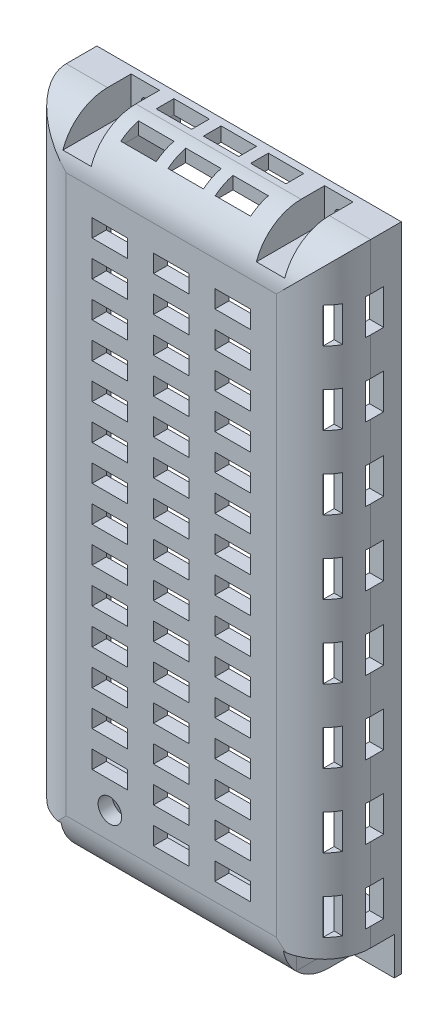
from build123d import *

# Parameters (mm, degrees)
ESBO_O1_W                = 129
ESBO_O1_H                = 276
ESBO_O1_R                = 1.6
RESSALTO_EXTRUS_O1_DEPTH = 3
ESBO_O4_W                = 70
ESBO_O4_H                = 6
ESBO_O4_W_2              = 6
ESBO_O4_H_2              = 100
RESSALTO_EXTRUS_O2_DEPTH = 24
RESSALTO_EXTRUS_O3_DEPTH = 6
RESSALTO_EXTRUS_O5_DEPTH = 27
RESSALTO_EXTRUS_O6_DEPTH = 94
FILETE1_R                = 20
ESBO_O9_R                = 5
ESBO_O9_W                = 15
ESBO_O9_H                = 7.5
CORTE_EXTRUS_O1_DEPTH    = 6
ESBO_O10_W               = 15
ESBO_O10_H               = 7.5
CORTE_EXTRUS_O2_DEPTH    = 6
ESBO_O11_W               = 15
ESBO_O11_H               = 7.5
CORTE_EXTRUS_O3_DEPTH    = 6
ESBO_O12_W               = 7.5
ESBO_O12_H               = 15
CORTE_EXTRUS_O4_DEPTH    = 6


with BuildPart() as part:
    # Esboço1 → Ressalto-extrusão1 (new body)
    with BuildSketch(Plane.XY):
        Rectangle(ESBO_O1_W, ESBO_O1_H)
        with Locations((-53.125, -128)):
            Circle(ESBO_O1_R, mode=Mode.SUBTRACT)
        with Locations((-41, 130.5)):
            Circle(ESBO_O1_R, mode=Mode.SUBTRACT)
        with Locations(Location((41, 130.5, 0), (0, 0, 180))):
            Circle(ESBO_O1_R, mode=Mode.SUBTRACT)
        with Locations(Location((53.125, -128, 0), (0, 0, 180))):
            Circle(ESBO_O1_R, mode=Mode.SUBTRACT)
        Polygon((-47.125, -132), (-47.125, -122), (-58.5, -122), (-58.5, 132), (-47, 132), (-47, 124.5), (-35, 124.5), (-35, 132), (35, 132), (35, 124.5), (47, 124.5), (47, 132), (58.5, 132), (58.5, -122), (47.125, -122), (47.125, -132), align=None, mode=Mode.SUBTRACT)
    extrude(amount=RESSALTO_EXTRUS_O1_DEPTH)

    # Esboço4 → Ressalto-extrusão2 (add)
    with BuildSketch(Plane.XY.offset(3)):
        Polygon((-64.5, 138), (-64.5, 72), (-58.5, 72), (-58.5, 132), (-47, 132), (-47, 138), align=None)
        with Locations((0, 135)):
            Rectangle(ESBO_O4_W, ESBO_O4_H)
        Polygon((47, 132), (47, 138), (64.5, 138), (64.5, 72), (58.5, 72), (58.5, 132), align=None)
        Polygon((-47.125, -132), (-47.125, -138), (47, -138), (47.125, -132), align=None)
        with Locations((-61.5, -72)):
            Rectangle(ESBO_O4_W_2, ESBO_O4_H_2)
        with Locations((61.5, -72)):
            Rectangle(ESBO_O4_W_2, ESBO_O4_H_2)
    extrude(amount=RESSALTO_EXTRUS_O2_DEPTH)

    # Esboço5 → Ressalto-extrusão3 (add)
    with BuildSketch(Plane.XY.offset(27)):
        Polygon((-35, 132), (-35, 138), (35, 138), (35, 132), (35, 124.5), (47, 124.5), (47, 132), (47, 138), (64.5, 138), (64.5, 72), (58.5, 72), (-64.5, 72), (-64.5, 138), (-47, 138), (-47, 124.5), (-35, 124.5), align=None)
        Polygon((-47.125, -138), (47, -138), (47.125, -122), (64.5, -122), (64.5, -22), (-64.5, -22), (-64.5, -122), (-47.125, -122), align=None)
    extrude(amount=RESSALTO_EXTRUS_O3_DEPTH)

    # Esboço7 → Ressalto-extrusão5 (add)
    with BuildSketch(Plane(origin=(0, 0, 27), x_dir=(-1, 0, 0), z_dir=(0, 0, -1))):
        Polygon((-47, 132), (-53, 132), (-53, 118.5), (-29, 118.5), (-29, 132), (-35, 132), (-35, 124.5), (-47, 124.5), align=None)
        Polygon((47.125, -132), (47.125, -122), (58.5, -122), (58.5, -116), (41.125, -116), (41.125, -132), align=None)
        Polygon((47, 124.5), (47, 132), (53, 132), (53, 118.5), (29, 118.5), (29, 132), (35, 132), (35, 124.5), align=None)
        Polygon((-41.125, -132), (-47.125, -132), (-47.125, -122), (-58.5, -122), (-58.5, -116), (-41.125, -116), align=None)
    extrude(amount=RESSALTO_EXTRUS_O5_DEPTH)

    # Esboço8 → Ressalto-extrusão6 (add)
    with BuildSketch(Plane(origin=(0, -22, 0), x_dir=(1, 0, 0), z_dir=(0, 1, 0))):
        Polygon((-58.5, -3), (-64.5, -3), (-64.5, -33), (64.5, -33), (64.5, -3), (58.5, -3), (58.5, -27), (-58.5, -27), align=None)
    extrude(amount=RESSALTO_EXTRUS_O6_DEPTH)

    # Filete1
    # the kernel refuses this fillet: 20 mm, written as the material it takes off along each edge
    with BuildSketch(Plane(origin=(-85, 138, 33), x_dir=(0, 0, -1), z_dir=(1, 0, 0))) as filete1_piece_1:
        with BuildLine():
            CenterArc((FILETE1_R, -FILETE1_R), FILETE1_R, 90, 90)
            Line((0, -FILETE1_R), (0, 0))
            Line((0, 0), (FILETE1_R, 0))
        make_face()
    extrude(amount=170, mode=Mode.SUBTRACT)
    with BuildSketch(Plane(origin=(-97.125, -138, 33), x_dir=(0, 0, -1), z_dir=(1, 0, 0))) as filete1_piece_2:
        with BuildLine():
            CenterArc((FILETE1_R, FILETE1_R), FILETE1_R, 180, 90)
            Line((0, FILETE1_R), (0, 0))
            Line((0, 0), (FILETE1_R, 0))
        make_face()
    extrude(amount=194.125, mode=Mode.SUBTRACT)
    with BuildSketch(Plane(origin=(64.5, -172, 33), x_dir=(0, 0, -1), z_dir=(0, 1, 0)), Plane(origin=(-64.5, -172, 33), x_dir=(1, 0, 0), z_dir=(0, 1, 0))) as filete1_piece_3:
        with BuildLine():
            CenterArc((FILETE1_R, FILETE1_R), FILETE1_R, 180, 90)
            Line((0, FILETE1_R), (0, 0))
            Line((0, 0), (FILETE1_R, 0))
        make_face()
    extrude(amount=360, mode=Mode.SUBTRACT)

    # Esboço9 → Corte-extrusão1 (cut)
    with BuildSketch(Plane.XY.offset(33)):
        with Locations((-26, -106.75)):
            Circle(ESBO_O9_R)
        with Locations((0, -106.75)):
            Rectangle(ESBO_O9_W, ESBO_O9_H)
        with Locations((26, -106.75)):
            Rectangle(ESBO_O9_W, ESBO_O9_H)
        with Locations((-26, -91.75)):
            Rectangle(ESBO_O9_W, ESBO_O9_H)
        with Locations((0, -91.75)):
            Rectangle(ESBO_O9_W, ESBO_O9_H)
        with Locations((26, -91.75)):
            Rectangle(ESBO_O9_W, ESBO_O9_H)
        with Locations((-26, -76.75)):
            Rectangle(ESBO_O9_W, ESBO_O9_H)
        with Locations((0, -76.75)):
            Rectangle(ESBO_O9_W, ESBO_O9_H)
        with Locations((26, -76.75)):
            Rectangle(ESBO_O9_W, ESBO_O9_H)
        with Locations((-26, -61.75)):
            Rectangle(ESBO_O9_W, ESBO_O9_H)
        with Locations((0, -61.75)):
            Rectangle(ESBO_O9_W, ESBO_O9_H)
        with Locations((26, -61.75)):
            Rectangle(ESBO_O9_W, ESBO_O9_H)
        with Locations((-26, -46.75)):
            Rectangle(ESBO_O9_W, ESBO_O9_H)
        with Locations((0, -46.75)):
            Rectangle(ESBO_O9_W, ESBO_O9_H)
        with Locations((26, -46.75)):
            Rectangle(ESBO_O9_W, ESBO_O9_H)
        with Locations((-26, -31.75)):
            Rectangle(ESBO_O9_W, ESBO_O9_H)
        with Locations((0, -31.75)):
            Rectangle(ESBO_O9_W, ESBO_O9_H)
        with Locations((26, -31.75)):
            Rectangle(ESBO_O9_W, ESBO_O9_H)
        with Locations((-26, -16.75)):
            Rectangle(ESBO_O9_W, ESBO_O9_H)
        with Locations((0, -16.75)):
            Rectangle(ESBO_O9_W, ESBO_O9_H)
        with Locations((26, -16.75)):
            Rectangle(ESBO_O9_W, ESBO_O9_H)
        with Locations((-26, -1.75)):
            Rectangle(ESBO_O9_W, ESBO_O9_H)
        with Locations((0, -1.75)):
            Rectangle(ESBO_O9_W, ESBO_O9_H)
        with Locations((26, -1.75)):
            Rectangle(ESBO_O9_W, ESBO_O9_H)
        with Locations((-26, 13.25)):
            Rectangle(ESBO_O9_W, ESBO_O9_H)
        with Locations((0, 13.25)):
            Rectangle(ESBO_O9_W, ESBO_O9_H)
        with Locations((26, 13.25)):
            Rectangle(ESBO_O9_W, ESBO_O9_H)
        with Locations((-26, 28.25)):
            Rectangle(ESBO_O9_W, ESBO_O9_H)
        with Locations((0, 28.25)):
            Rectangle(ESBO_O9_W, ESBO_O9_H)
        with Locations((26, 28.25)):
            Rectangle(ESBO_O9_W, ESBO_O9_H)
        with Locations((-26, 43.25)):
            Rectangle(ESBO_O9_W, ESBO_O9_H)
        with Locations((0, 43.25)):
            Rectangle(ESBO_O9_W, ESBO_O9_H)
        with Locations((26, 43.25)):
            Rectangle(ESBO_O9_W, ESBO_O9_H)
        with Locations((-26, 58.25)):
            Rectangle(ESBO_O9_W, ESBO_O9_H)
        with Locations((0, 58.25)):
            Rectangle(ESBO_O9_W, ESBO_O9_H)
        with Locations((26, 58.25)):
            Rectangle(ESBO_O9_W, ESBO_O9_H)
        with Locations((-26, 73.25)):
            Rectangle(ESBO_O9_W, ESBO_O9_H)
        with Locations((0, 73.25)):
            Rectangle(ESBO_O9_W, ESBO_O9_H)
        with Locations((26, 73.25)):
            Rectangle(ESBO_O9_W, ESBO_O9_H)
        with Locations((-26, 88.25)):
            Rectangle(ESBO_O9_W, ESBO_O9_H)
        with Locations((0, 88.25)):
            Rectangle(ESBO_O9_W, ESBO_O9_H)
        with Locations((26, 88.25)):
            Rectangle(ESBO_O9_W, ESBO_O9_H)
        with Locations((-26, 103.25)):
            Rectangle(ESBO_O9_W, ESBO_O9_H)
        with Locations((0, 103.25)):
            Rectangle(ESBO_O9_W, ESBO_O9_H)
        with Locations((26, 103.25)):
            Rectangle(ESBO_O9_W, ESBO_O9_H)
    extrude(amount=-CORTE_EXTRUS_O1_DEPTH, mode=Mode.SUBTRACT)

    # Esboço10 → Corte-extrusão2 (cut)
    with BuildSketch(Plane.XZ.offset(138)):
        with Locations((-32.125, 24.25)):
            Rectangle(ESBO_O10_W, ESBO_O10_H)
        with Locations((-2.125, 24.25)):
            Rectangle(ESBO_O10_W, ESBO_O10_H)
        with Locations((27.875, 24.25)):
            Rectangle(ESBO_O10_W, ESBO_O10_H)
        with Locations((-32.125, 11.75)):
            Rectangle(ESBO_O10_W, ESBO_O10_H)
        with Locations((-2.125, 11.75)):
            Rectangle(ESBO_O10_W, ESBO_O10_H)
        with Locations((27.875, 11.75)):
            Rectangle(ESBO_O10_W, ESBO_O10_H)
    extrude(amount=-CORTE_EXTRUS_O2_DEPTH, mode=Mode.SUBTRACT)

    # Esboço11 → Corte-extrusão3 (cut)
    with BuildSketch(Plane(origin=(0, 138, 0), x_dir=(1, 0, 0), z_dir=(0, 1, 0))):
        with Locations((-21.365084691, -21.75)):
            Rectangle(ESBO_O11_W, ESBO_O11_H)
        with Locations((-1.365084691, -21.75)):
            Rectangle(ESBO_O11_W, ESBO_O11_H)
        with Locations((18.634915309, -21.75)):
            Rectangle(ESBO_O11_W, ESBO_O11_H)
        with Locations((-1.365084691, -6.75)):
            Rectangle(ESBO_O11_W, ESBO_O11_H)
        with Locations((18.634915309, -6.75)):
            Rectangle(ESBO_O11_W, ESBO_O11_H)
        with Locations((-21.365084691, -6.75)):
            Rectangle(ESBO_O11_W, ESBO_O11_H)
    extrude(amount=-CORTE_EXTRUS_O3_DEPTH, mode=Mode.SUBTRACT)

    # Esboço12 → Corte-extrusão4 (cut)
    with BuildSketch(Plane.ZY.offset(64.5)):
        with Locations((11.25, 110.5)):
            Rectangle(ESBO_O12_W, ESBO_O12_H)
        with Locations((26.25, 110.5)):
            Rectangle(ESBO_O12_W, ESBO_O12_H)
        with Locations((26.25, 79.5)):
            Rectangle(ESBO_O12_W, ESBO_O12_H)
        with Locations((26.25, 48.5)):
            Rectangle(ESBO_O12_W, ESBO_O12_H)
        with Locations((26.25, 17.5)):
            Rectangle(ESBO_O12_W, ESBO_O12_H)
        with Locations((26.25, -13.5)):
            Rectangle(ESBO_O12_W, ESBO_O12_H)
        with Locations((26.25, -44.5)):
            Rectangle(ESBO_O12_W, ESBO_O12_H)
        with Locations((26.25, -75.5)):
            Rectangle(ESBO_O12_W, ESBO_O12_H)
        with Locations((26.25, -106.5)):
            Rectangle(ESBO_O12_W, ESBO_O12_H)
        with Locations((11.25, 79.5)):
            Rectangle(ESBO_O12_W, ESBO_O12_H)
        with Locations((11.25, 48.5)):
            Rectangle(ESBO_O12_W, ESBO_O12_H)
        with Locations((11.25, 17.5)):
            Rectangle(ESBO_O12_W, ESBO_O12_H)
        with Locations((11.25, -13.5)):
            Rectangle(ESBO_O12_W, ESBO_O12_H)
        with Locations((11.25, -44.5)):
            Rectangle(ESBO_O12_W, ESBO_O12_H)
        with Locations((11.25, -75.5)):
            Rectangle(ESBO_O12_W, ESBO_O12_H)
        with Locations((11.25, -106.5)):
            Rectangle(ESBO_O12_W, ESBO_O12_H)
    corte_extrus_o4 = extrude(amount=-CORTE_EXTRUS_O4_DEPTH, mode=Mode.SUBTRACT)

    # Espelhar2: Corte-extrusão4 across plane
    add(corte_extrus_o4.mirror(Plane(origin=(0, 0, 0), x_dir=(0, 0, 1), z_dir=(1, 0, 0))), mode=Mode.SUBTRACT)


solid = part.part
